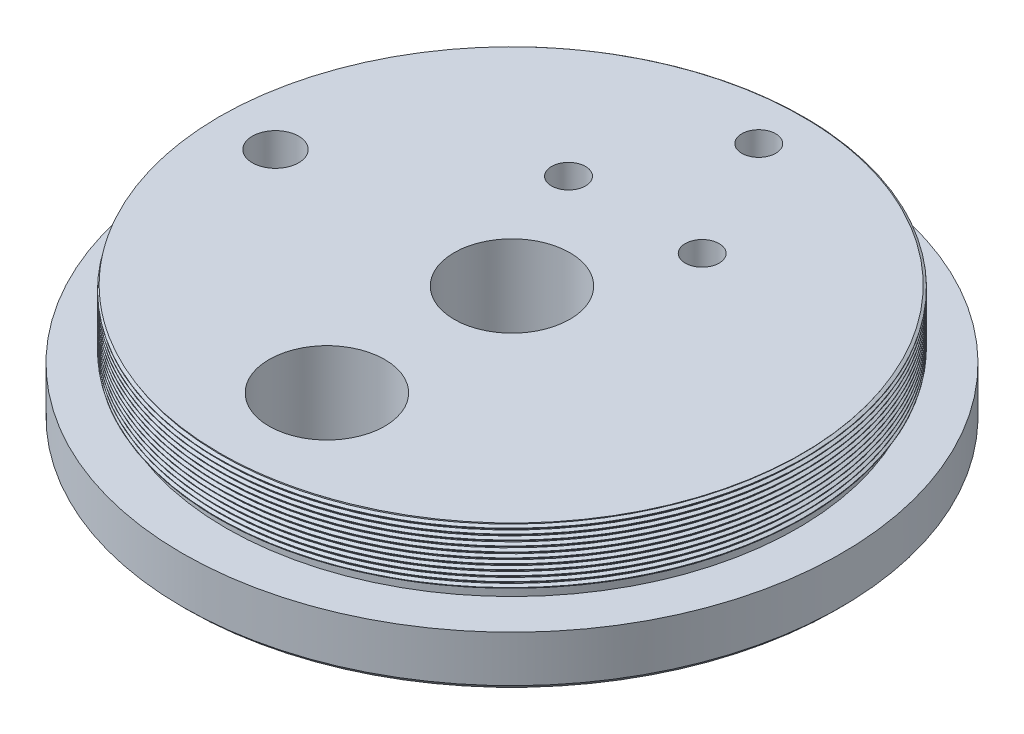
from build123d import *

# Parameters (mm, degrees)
THREAD_1_PITCH                = 1.5
CHAMFER_1_SIZE                = 0.5
SKETCH_3_R                    = 5.625
CUT_EXTRUDE_1_DEPTH           = 47.761683057
HOLE_WIZARD_M41_D             = 3.3
HOLE_WIZARD_M41_2_D           = 4.5
HOLE_WIZARD_M41_2_CSINK_D     = 9.4
HOLE_WIZARD_M41_2_CSINK_ANGLE = 90
THREAD1_PITCH                 = 0.5


with BuildPart() as part:
    # Sketch 1 → Повернуть1 (revolve)
    with BuildSketch(Plane.XY, mode=Mode.PRIVATE) as revolve_1_sk:
        Polygon((-4.25, 0), (-32.05, 0), (-32.05, 5), (-27.8, 5), (-27.8, 6), (-28.5, 6), (-28.5, 11.5), (-4.25, 11.5), align=None)
    revolve(revolve_1_sk.sketch.rotate(Axis((0, 0, 0), (0, -1, 0)), 270), axis=Axis((0, 0, 0), (0, -1, 0)))

    # Резьба1: the profile of Sketch 1 2 profile screwed along a right-hand helix of 13.333333 turns, 8 arcs to a turn; built about Z, then put on its axis
    thread_1_z = Axis((0, 0, 0), (0, 0, 1))
    thread_1_corners = [(4.2497, 0, -0.000173205), (5.061898812, 0, 0.468749998), (5.061898812, 0, 0.656249998), (4.2497, 0, 1.125173201)]
    with BuildLine(mode=Mode.PRIVATE) as thread_1_profile:
        Line(thread_1_corners[0], thread_1_corners[1])
        Line(thread_1_corners[1], thread_1_corners[2])
        Line(thread_1_corners[2], thread_1_corners[3])
        Line(thread_1_corners[3], thread_1_corners[0])
    thread_1_cap = Face(thread_1_profile.wire())
    thread_1_turn_angles = [0, 22.5, 45, 67.5, 90, 112.5, 135, 157.5, 180, 202.5, 225, 247.5, 270, 292.5, 315, 337.5, 360]
    thread_1_turn_weights = [1, 0.9238795325112867, 1, 0.9238795325112867, 1, 0.9238795325112867, 1, 0.9238795325112867, 1, 0.9238795325112867, 1, 0.9238795325112867, 1, 0.9238795325112867, 1, 0.9238795325112867, 1]
    thread_1_turn_rails = [Edge.make_bspline([Vector(p[0], p[1], 0).rotate(thread_1_z, thread_1_turn_angles[k]) / thread_1_turn_weights[k] + Vector(0, 0, p[2] + THREAD_1_PITCH * thread_1_turn_angles[k] / 360) for k in range(17)], [0, 0, 0, 1, 1, 2, 2, 3, 3, 4, 4, 5, 5, 6, 6, 7, 7, 8, 8, 8], 2, thread_1_turn_weights) for p in thread_1_corners]
    thread_1_turn_sides = [Face.make_surface_from_curves(thread_1_turn_rails[p[0]], thread_1_turn_rails[p[1]]) for p in [(0, 1), (1, 2), (2, 3), (3, 0)]]
    thread_1_last_angles = [4680, 4702.5, 4725, 4747.5, 4770, 4785, 4800]
    thread_1_last_weights = [1, 0.9238795325112867, 1, 0.9238795325112867, 1, 0.9659258262890703, 1]
    thread_1_last_rails = [Edge.make_bspline([Vector(p[0], p[1], 0).rotate(thread_1_z, thread_1_last_angles[k]) / thread_1_last_weights[k] + Vector(0, 0, p[2] + THREAD_1_PITCH * thread_1_last_angles[k] / 360) for k in range(7)], [0, 0, 0, 1, 1, 2, 2, 3, 3, 3], 2, thread_1_last_weights) for p in thread_1_corners]
    thread_1_last_sides = [Face.make_surface_from_curves(thread_1_last_rails[p[0]], thread_1_last_rails[p[1]]) for p in [(0, 1), (1, 2), (2, 3), (3, 0)]]
    thread_1 = Plane(origin=(0, 12.5, 0), x_dir=(-1, 0, 0), z_dir=(0, -1, 0)) * Solid(Shell([*[p.moved(Location((0, 0, THREAD_1_PITCH * i))) for i in range(13) for p in thread_1_turn_sides], *thread_1_last_sides, thread_1_cap, thread_1_cap.rotate(thread_1_z, 4800).moved(Location((0, 0, THREAD_1_PITCH * 4800 / 360)))]))
    add(thread_1, mode=Mode.SUBTRACT)

    # Фаска1
    chamfer_1_edges = [part.edges().sort_by_distance(p)[0] for p in [
        (0, 0, -32.05),
    ]]
    chamfer(chamfer_1_edges, length=CHAMFER_1_SIZE)

    # Эскиз3 → Вырез-Вытянуть1 (cut, through all)
    with BuildSketch(Plane.XZ):
        with Locations(Location((0, 18, 0), (0, 0, 270))):
            Circle(SKETCH_3_R)
        with Locations(Location((0, 0, 0), (0, 0, 270))):
            Circle(SKETCH_3_R)
    extrude(amount=-CUT_EXTRUDE_1_DEPTH, mode=Mode.SUBTRACT)

    # Hole Wizard M41 (through all)
    with Locations(Plane(origin=(0, 0, 0), x_dir=(-1, 0, 0), z_dir=(0, -1, 0))):
        with Locations((0, 24), (-6.5, 12), (6.5, 12)):
            Hole(HOLE_WIZARD_M41_D / 2)

    # Hole Wizard M41 2 (through all)
    with Locations(Plane(origin=(0, 0, 0), x_dir=(-1, 0, 0), z_dir=(0, -1, 0))):
        with Locations((23, 0)):
            CounterSinkHole(HOLE_WIZARD_M41_2_D / 2, HOLE_WIZARD_M41_2_CSINK_D / 2, counter_sink_angle=HOLE_WIZARD_M41_2_CSINK_ANGLE)

    # Thread1: the profile of Thread Profile1 profile screwed along a right-hand helix of 14 turns, 6 arcs to a turn; built about Z, then put on its axis
    thread1_z = Axis((0, 0, 0), (0, 0, 1))
    thread1_corners = [(28.5003, 0, -0.000173205), (28.5003, 0, 0.437673204), (28.229367062, 0, 0.281249999), (28.229367062, 0, 0.156249999)]
    with BuildLine(mode=Mode.PRIVATE) as thread1_profile:
        Line(thread1_corners[0], thread1_corners[1])
        Line(thread1_corners[1], thread1_corners[2])
        Line(thread1_corners[2], thread1_corners[3])
        Line(thread1_corners[3], thread1_corners[0])
    thread1_cap = Face(thread1_profile.wire())
    thread1_turn_angles = [0, 30, 60, 90, 120, 150, 180, 210, 240, 270, 300, 330, 360]
    thread1_turn_weights = [1, 0.8660254037844387, 1, 0.8660254037844387, 1, 0.8660254037844387, 1, 0.8660254037844387, 1, 0.8660254037844387, 1, 0.8660254037844387, 1]
    thread1_turn_rails = [Edge.make_bspline([Vector(p[0], p[1], 0).rotate(thread1_z, thread1_turn_angles[k]) / thread1_turn_weights[k] + Vector(0, 0, p[2] + THREAD1_PITCH * thread1_turn_angles[k] / 360) for k in range(13)], [0, 0, 0, 1, 1, 2, 2, 3, 3, 4, 4, 5, 5, 6, 6, 6], 2, thread1_turn_weights) for p in thread1_corners]
    thread1_turn_sides = [Face.make_surface_from_curves(thread1_turn_rails[p[0]], thread1_turn_rails[p[1]]) for p in [(0, 1), (1, 2), (2, 3), (3, 0)]]
    thread1 = Plane(origin=(0, 13, 0), x_dir=(-1, 0, 0), z_dir=(0, -1, 0)) * Solid(Shell([*[p.moved(Location((0, 0, THREAD1_PITCH * i))) for i in range(14) for p in thread1_turn_sides], thread1_cap, thread1_cap.rotate(thread1_z, 5040).moved(Location((0, 0, THREAD1_PITCH * 5040 / 360)))]))
    add(thread1, mode=Mode.SUBTRACT)


solid = part.part
